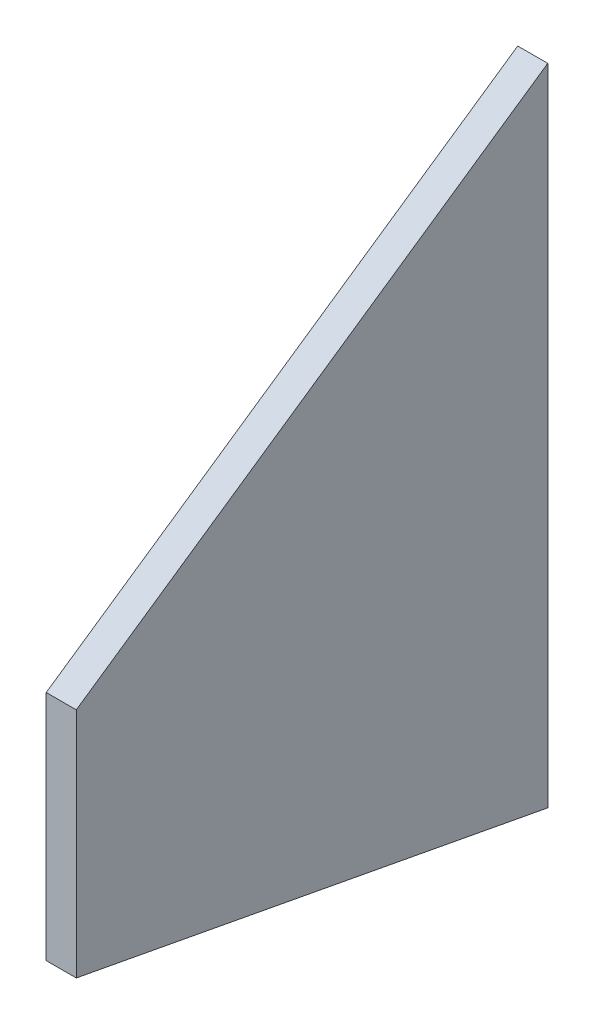
from build123d import *

# Parameters (mm, degrees)
BOSS_EXTRUDE1_DEPTH = 152.4
SKETCH3_OUTSIDE_W   = 237.922
SKETCH3_OUTSIDE_H   = 226.36
CUT_EXTRUDE2_DEPTH  = 365.792952335
SHELL1_T            = -6.35
SKETCH8_W           = 266.062607669
SKETCH8_H           = 282.191647152
CUT_EXTRUDE6_DEPTH  = 300.618382774
CUT_EXTRUDE3_DEPTH  = 350.742043935
CUT_EXTRUDE4_DEPTH  = 296.012320666


with BuildPart() as part:
    # Sketch2 → Boss-Extrude1 (new body)
    with BuildSketch(Plane(origin=(0, 0, 0), x_dir=(1, 0, 0), z_dir=(0, 1, 0))):
        Polygon((-57.15, 0), (224.536, 0), (-24.357683353, -163.961583236), align=None)
    extrude(amount=BOSS_EXTRUDE1_DEPTH)

    # Sketch3 outside → Cut-Extrude2 (cut, through all)
    with BuildSketch(Plane(origin=(-63.5, 0, 0), x_dir=(0, 0, -1), z_dir=(1, 0, 0))):
        with Locations((-81.981, 76.2)):
            Rectangle(SKETCH3_OUTSIDE_W, SKETCH3_OUTSIDE_H)
        Polygon((0, 152.4), (-127, 107.95), (-217.714285714, 76.2), (-127, 44.45), (0, 0), align=None, mode=Mode.SUBTRACT)
    extrude(amount=CUT_EXTRUDE2_DEPTH, mode=Mode.SUBTRACT)

    # Shell1
    shell1_openings = [part.faces().sort_by_distance(p)[0] for p in [
        (83.693, 76.2, 0),
    ]]
    offset(amount=SHELL1_T, openings=shell1_openings, kind=Kind.INTERSECTION)

    # Sketch8 → Cut-Extrude6 (cut, through all)
    with BuildSketch(Plane.XY.offset(127)):
        with Locations((40.834882022, 90.229060284)):
            Rectangle(SKETCH8_W, SKETCH8_H)
    extrude(amount=CUT_EXTRUDE6_DEPTH, mode=Mode.SUBTRACT)

    # Sketch4 → Cut-Extrude3 (cut, through all)
    with BuildSketch(Plane(origin=(-63.5, 0, 0), x_dir=(0, 0, -1), z_dir=(1, 0, 0))):
        Polygon((0, 152.4), (0, 145.672295618), (-163.961583236, 88.285741485), (-163.961583236, 95.013445867), align=None)
        Polygon((-163.961583236, 64.114258515), (0, 6.727704382), (0, 0), (-163.961583236, 57.386554133), align=None)
    extrude(amount=CUT_EXTRUDE3_DEPTH, mode=Mode.SUBTRACT)


with BuildPart() as cut_extrude3_piece_1:
    # of the separate pieces the step leaves, piece 1, a body of its own (cut_extrude3_pieces)
    add(part.part.solids().sort_by_distance((224.536, 6.727704382, 0))[0])

    # Sketch5 → Cut-Extrude4 (cut, through all)
    with BuildSketch(Plane(origin=(0, 149.86, 0), x_dir=(1, 0, 0), z_dir=(0, 1, 0))):
        Polygon((-19.604445393, -155.348999126), (-18.635799907, -160.192226553), (344.317071882, -160.192226553), (317.90319732, 72.866103233), (-35.113235742, 43.318472272), align=None)
    extrude(amount=-CUT_EXTRUDE4_DEPTH, mode=Mode.SUBTRACT)


with BuildPart() as cut_extrude3_piece_2:
    # of the separate pieces the step leaves, piece 2, a body of its own (cut_extrude3_pieces)
    add(part.part.solids().sort_by_distance((-31.75, 51.177704382, 127))[0])


solid = cut_extrude3_piece_2.part
